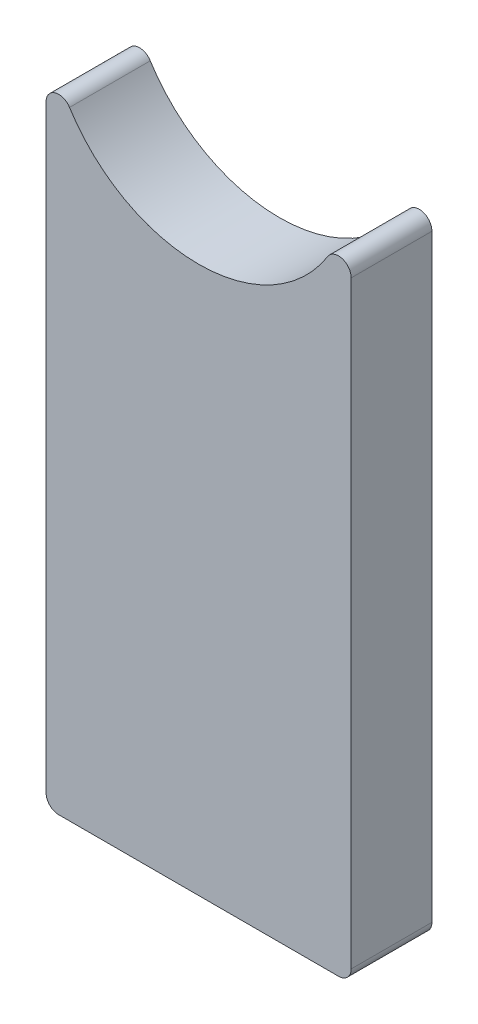
from build123d import *

# Parameters (mm, degrees)
BOSS_EXTRUDE1_DEPTH = 6.35
FILLET1_R           = 1


with BuildPart() as part:
    # Sketch1 → Boss-Extrude1 (new body)
    with BuildSketch(Plane.XY):
        with BuildLine():
            Line((-83.164877655, 19.413902033), (-83.164877655, -28.657894737))
            Line((-83.164877655, -28.657894737), (-59.164877655, -28.657894737))
            Line((-59.164877655, -28.657894737), (-59.164877655, 19.413902033))
            ThreePointArc((-59.164877655, 19.413902033), (-59.887527557, 20.374670956), (-61.011031501, 19.946840743))
            ThreePointArc((-61.011031501, 19.946840743), (-71.164877655, 14.342105263), (-81.318723809, 19.946840743))
            ThreePointArc((-81.318723809, 19.946840743), (-82.442227753, 20.374670956), (-83.164877655, 19.413902033))
        make_face()
    extrude(amount=BOSS_EXTRUDE1_DEPTH)

    # Fillet1
    fillet1_edges = [part.edges().sort_by_distance(p)[0] for p in [
        (-59.164877655, -28.657894737, 3.175),
        (-83.164877655, -28.657894737, 3.175),
    ]]
    fillet(fillet1_edges, radius=FILLET1_R)


solid = part.part
